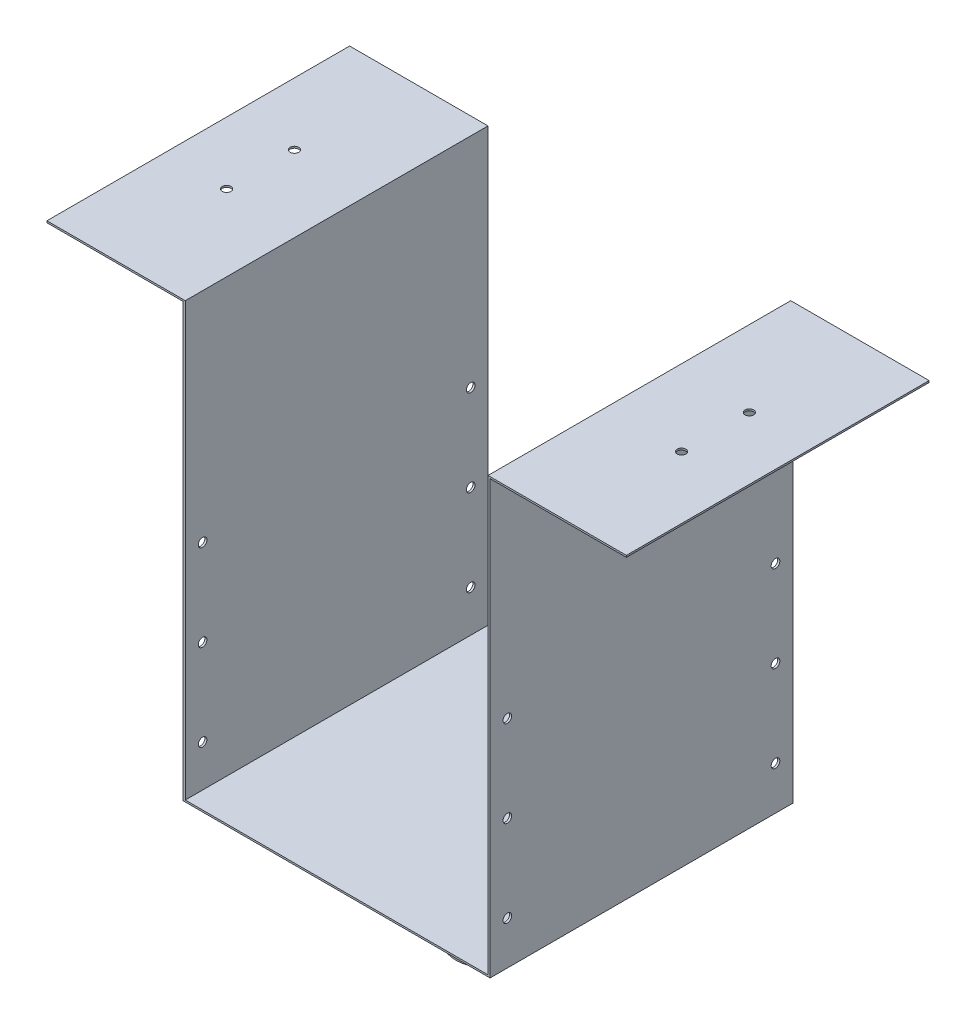
from build123d import *

# Parameters (mm, degrees)
SKETCH1_W           = 175
SKETCH1_H           = 175
BOSS_EXTRUDE1_DEPTH = 1
SKETCH2_W           = 1.2
SKETCH2_H           = 175
BOSS_EXTRUDE2_DEPTH = 250
SKETCH3_W           = 80
SKETCH3_H           = 175
BOSS_EXTRUDE3_DEPTH = 1
SKETCH4_R           = 2.5
CUT_EXTRUDE1_DEPTH  = 10
SKETCH6_R           = 2.5
CUT_EXTRUDE2_DEPTH  = 300
SKETCH7_R           = 18.5
SKETCH7_R_2         = 12.5
BOSS_EXTRUDE4_DEPTH = 70


with BuildPart() as part:
    # Sketch1 → Boss-Extrude1 (new body)
    with BuildSketch(Plane(origin=(0, 0, 0), x_dir=(1, 0, 0), z_dir=(0, 1, 0))):
        Rectangle(SKETCH1_W, SKETCH1_H)
    extrude(amount=BOSS_EXTRUDE1_DEPTH)

    # Sketch2 → Boss-Extrude2 (add)
    with BuildSketch(Plane.XZ):
        with Locations((-88.1, 0)):
            Rectangle(SKETCH2_W, SKETCH2_H)
        with Locations((88.1, 0)):
            Rectangle(SKETCH2_W, SKETCH2_H)
    extrude(amount=-BOSS_EXTRUDE2_DEPTH)

    # Sketch3 → Boss-Extrude3 (add)
    with BuildSketch(Plane(origin=(0, 250, 0), x_dir=(1, 0, 0), z_dir=(0, 1, 0))):
        with Locations((-127.5, 0)):
            Rectangle(SKETCH3_W, SKETCH3_H)
        with Locations((127.5, 0)):
            Rectangle(SKETCH3_W, SKETCH3_H)
    extrude(amount=BOSS_EXTRUDE3_DEPTH)

    # Sketch4 → Cut-Extrude1 (cut)
    with BuildSketch(Plane(origin=(0, 251, 0), x_dir=(1, 0, 0), z_dir=(0, 1, 0))):
        with Locations((131.5, 19.6)):
            Circle(SKETCH4_R)
        with Locations((131.5, -19.6)):
            Circle(SKETCH4_R)
        with Locations((-131.5, -19.6)):
            Circle(SKETCH4_R)
        with Locations((-131.5, 19.6)):
            Circle(SKETCH4_R)
    extrude(amount=-CUT_EXTRUDE1_DEPTH, mode=Mode.SUBTRACT)

    # Sketch6 → Cut-Extrude2 (cut)
    with BuildSketch(Plane(origin=(88.7, 0, 0), x_dir=(0, 0, -1), z_dir=(1, 0, 0))):
        with Locations((77.5, 25)):
            Circle(SKETCH6_R)
        with Locations((77.5, 75)):
            Circle(SKETCH6_R)
        with Locations((77.5, 125)):
            Circle(SKETCH6_R)
        with Locations((-77.5, 125)):
            Circle(SKETCH6_R)
        with Locations((-77.5, 75)):
            Circle(SKETCH6_R)
        with Locations((-77.5, 25)):
            Circle(SKETCH6_R)
    extrude(amount=-CUT_EXTRUDE2_DEPTH, mode=Mode.SUBTRACT)

    # Sketch7 → Boss-Extrude4 (add)
    with BuildSketch(Plane.XZ):
        Circle(SKETCH7_R)
        Circle(SKETCH7_R_2, mode=Mode.SUBTRACT)
    extrude(amount=BOSS_EXTRUDE4_DEPTH)


solid = part.part
